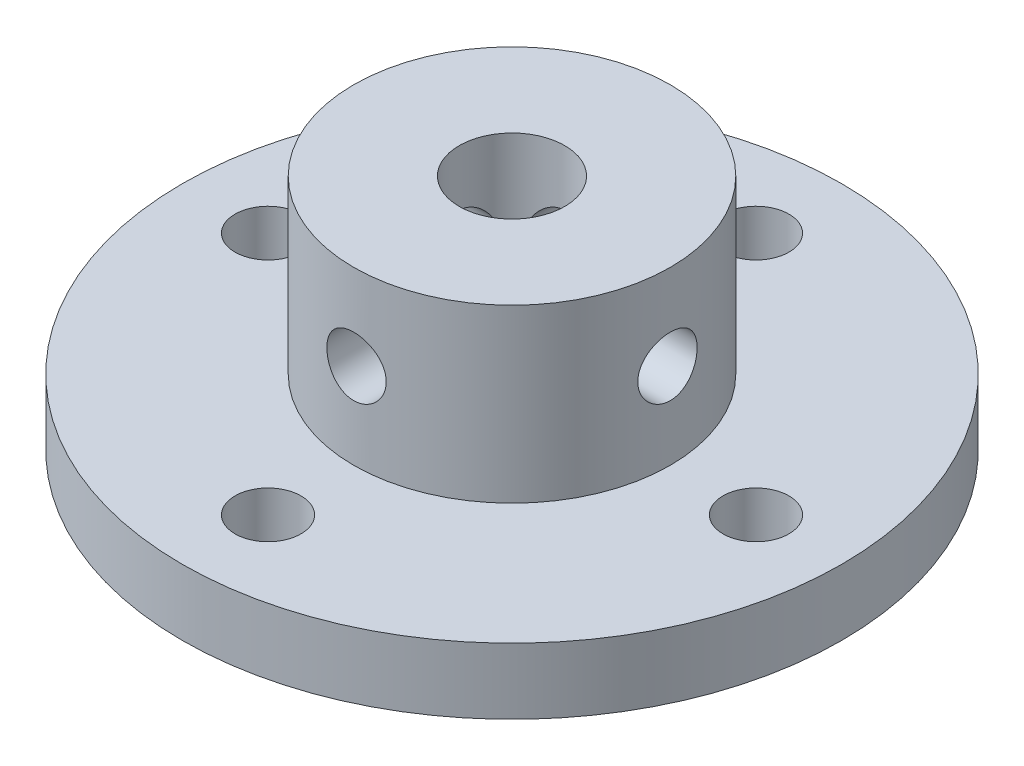
from build123d import *

# Parameters (mm, degrees)
SKETCH_1_R               = 25
EXTRUDE_1_DEPTH          = 5
SKETCH_2_R               = 12
EXTRUDE_2_DEPTH          = 13
SKETCH_3_R               = 4
CUT_EXTRUDE_1_DEPTH      = 40.67366885
SKETCH_4_R               = 2.5
CUT_EXTRUDE_2_DEPTH      = 38.669616404
CUT_EXTRUDE_3_DEPTH      = 40.67366885
CUT_EXTRUDE_3_DEPTH_BACK = 40.67366885
SKETCH_5_R               = 2.25
CUT_EXTRUDE_4_DEPTH      = 40.673668895
CUT_EXTRUDE_4_DEPTH_BACK = 40.673668895
SKETCH_6_R               = 2.25


with BuildPart() as part:
    # 草图1 → 凸台-拉伸1 (new body)
    with BuildSketch(Plane(origin=(0, 0, 0), x_dir=(1, 0, 0), z_dir=(0, 1, 0))):
        Circle(SKETCH_1_R)
    extrude(amount=EXTRUDE_1_DEPTH)

    # 草图2 → 凸台-拉伸2 (add)
    with BuildSketch(Plane(origin=(0, 5, 0), x_dir=(1, 0, 0), z_dir=(0, 1, 0))):
        Circle(SKETCH_2_R)
    extrude(amount=EXTRUDE_2_DEPTH)

    # 草图3 → 切除-拉伸1 (cut, through all)
    with BuildSketch(Plane(origin=(0, 18, 0), x_dir=(1, 0, 0), z_dir=(0, 1, 0))):
        Circle(SKETCH_3_R)
    extrude(amount=-CUT_EXTRUDE_1_DEPTH, mode=Mode.SUBTRACT)

    # 草图4 → 切除-拉伸2 (cut, through all)
    with BuildSketch(Plane(origin=(0, 5, 0), x_dir=(1, 0, 0), z_dir=(0, 1, 0))):
        with Locations((18.5, 0)):
            Circle(SKETCH_4_R)
        with Locations((0, 18.5)):
            Circle(SKETCH_4_R)
        with Locations((0, -18.5)):
            Circle(SKETCH_4_R)
        with Locations((-18.5, 0)):
            Circle(SKETCH_4_R)
    extrude(amount=-CUT_EXTRUDE_2_DEPTH, mode=Mode.SUBTRACT)

    # 草图5 → 切除-拉伸3 (cut, two sides: drawn at the far end of the back side and taken through both)
    with BuildSketch(Plane(origin=(0, 0, 0), x_dir=(0, 0, -1), z_dir=(1, 0, 0)).offset(-CUT_EXTRUDE_3_DEPTH_BACK)):
        with Locations((0, 11.5)):
            Circle(SKETCH_5_R)
    extrude(amount=CUT_EXTRUDE_3_DEPTH + CUT_EXTRUDE_3_DEPTH_BACK, mode=Mode.SUBTRACT)

    # 草图6 → 切除-拉伸4 (cut, two sides: drawn at the far end of the back side and taken through both)
    with BuildSketch(Plane.XY.offset(-CUT_EXTRUDE_4_DEPTH_BACK)):
        with Locations((0, 11.5)):
            Circle(SKETCH_6_R)
    extrude(amount=CUT_EXTRUDE_4_DEPTH + CUT_EXTRUDE_4_DEPTH_BACK, mode=Mode.SUBTRACT)


solid = part.part
